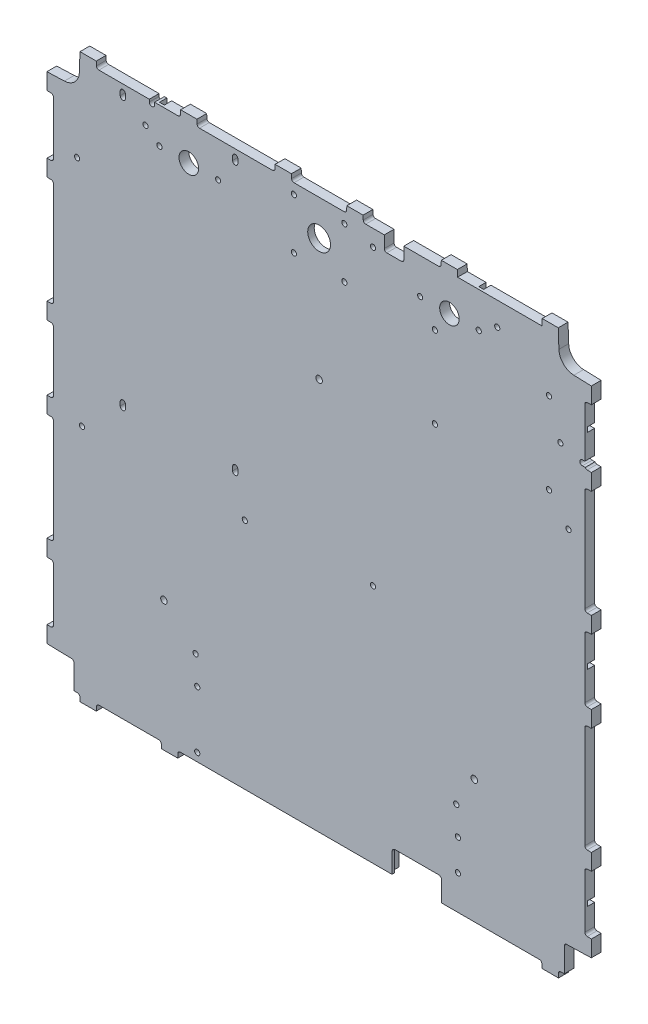
from build123d import *

# Parameters (mm, degrees)
SALIENTE_EXTRUIR1_DEPTH                              = 6
CROQUIS2_W                                           = 301
CROQUIS2_H                                           = 6
SALIENTE_EXTRUIR2_DEPTH                              = 20.342813889
CROQUIS3_W                                           = 39.720633844
CROQUIS3_H                                           = 4
CORTAR_EXTRUIR1_DEPTH                                = 241.454257604
CROQUIS4_W                                           = 4
CROQUIS4_H                                           = 35.720633844
CORTAR_EXTRUIR2_DEPTH                                = 241.454257604
CROQUIS5_W                                           = 4
CROQUIS5_H                                           = 39.720633844
CORTAR_EXTRUIR3_DEPTH                                = 241.454257604
CROQUIS6_W                                           = 4
CROQUIS6_H                                           = 35.720633844
CORTAR_EXTRUIR4_DEPTH                                = 241.454257604
CROQUIS7_W                                           = 51.8
CROQUIS7_H                                           = 4
CORTAR_EXTRUIR5_DEPTH                                = 241.454257604
CORTAR_EXTRUIR6_DEPTH                                = 4.5
CORTAR_EXTRUIR7_DEPTH                                = 4.5
CORTAR_EXTRUIR8_DEPTH                                = 4.5
CORTAR_EXTRUIR9_DEPTH                                = 4.5
CORTAR_EXTRUIR10_DEPTH                               = 4.5
CORTAR_EXTRUIR11_DEPTH                               = 4.5
CORTAR_EXTRUIR12_DEPTH                               = 4.5
CORTAR_EXTRUIR13_DEPTH                               = 241.454257604
CROQUIS16_W                                          = 1.75
CROQUIS16_H                                          = 4.5
CORTAR_EXTRUIR14_DEPTH                               = 14.1
CROQUIS17_W                                          = 131.410316922
CROQUIS17_H                                          = 4
CORTAR_EXTRUIR15_DEPTH                               = 241.454257604
CROQUIS18_W                                          = 1.75
CROQUIS18_H                                          = 4.5
CORTAR_EXTRUIR16_DEPTH                               = 14.1
CORTAR_EXTRUIR17_DEPTH                               = 4.5
CORTAR_EXTRUIR18_DEPTH                               = 4.5
CORTAR_EXTRUIR19_DEPTH                               = 4.5
CORTAR_EXTRUIR20_DEPTH                               = 4.5
CORTAR_EXTRUIR21_DEPTH                               = 4.5
CROQUIS24_W                                          = 48
CROQUIS24_H                                          = 4
CORTAR_EXTRUIR22_DEPTH                               = 241.454257604
CROQUIS25_W                                          = 34
CROQUIS25_H                                          = 4
CORTAR_EXTRUIR23_DEPTH                               = 241.454257604
CORTAR_EXTRUIR24_DEPTH                               = 241.454257604
CORTAR_EXTRUIR25_DEPTH                               = 241.454257604
CORTAR_EXTRUIR26_DEPTH                               = 241.454257604
CORTAR_EXTRUIR27_DEPTH                               = 241.454257604
CROQUIS30_W                                          = 3.560316922
CROQUIS30_H                                          = 4
CORTAR_EXTRUIR28_DEPTH                               = 241.454257604
CROQUIS31_W                                          = 4
CROQUIS31_H                                          = 65.720633844
CORTAR_EXTRUIR29_DEPTH                               = 241.454257604
CROQUIS32_W                                          = 4
CROQUIS32_H                                          = 65.720633844
CORTAR_EXTRUIR30_DEPTH                               = 241.454257604
CORTAR_EXTRUIR31_DEPTH                               = 241.454257604
CORTAR_EXTRUIR32_DEPTH                               = 241.454257604
CORTAR_EXTRUIR33_DEPTH                               = 241.454257604
CORTAR_EXTRUIR34_DEPTH                               = 241.454257604
CORTAR_EXTRUIR35_DEPTH                               = 241.454257604
CORTAR_EXTRUIR36_DEPTH                               = 241.454257604
CORTAR_EXTRUIR37_DEPTH                               = 4.5
CORTAR_EXTRUIR38_DEPTH                               = 4.5
CROQUIS42_W                                          = 20
CROQUIS42_H                                          = 4.5
CORTAR_EXTRUIR39_DEPTH                               = 15
CORTAR_EXTRUIR40_DEPTH                               = 4.5
NGULO_DE_SALIDA1_ANGLE                               = 1.443471022
NGULO_DE_SALIDA2_ANGLE                               = 2
NGULO_DE_SALIDA3_ANGLE                               = 2
NGULO_DE_SALIDA4_ANGLE                               = 1.443471022
NGULO_DE_SALIDA5_ANGLE                               = 2
NGULO_DE_SALIDA6_ANGLE                               = 2
NGULO_DE_SALIDA7_ANGLE                               = 2
NGULO_DE_SALIDA8_ANGLE                               = 2
NGULO_DE_SALIDA9_ANGLE                               = 2
NGULO_DE_SALIDA10_ANGLE                              = 2
NGULO_DE_SALIDA11_ANGLE                              = 2
NGULO_DE_SALIDA12_ANGLE                              = 2
NGULO_DE_SALIDA13_ANGLE                              = 2
NGULO_DE_SALIDA14_ANGLE                              = 2
NGULO_DE_SALIDA15_ANGLE                              = 2
NGULO_DE_SALIDA16_ANGLE                              = 2
NGULO_DE_SALIDA17_ANGLE                              = 2
NGULO_DE_SALIDA18_ANGLE                              = 2
NGULO_DE_SALIDA19_ANGLE                              = 2
NGULO_DE_SALIDA20_ANGLE                              = 2
NGULO_DE_SALIDA21_ANGLE                              = 2
NGULO_DE_SALIDA22_ANGLE                              = 2
DI_METRO_DE_TALADRO_12_0_12_1_D                      = 12
DI_METRO_DE_TALADRO_4_0_4_1_D                        = 4
DI_METRO_DE_TALADRO_3_2_3_2_1_D                      = 3.2
DI_METRO_DE_TALADRO_3_2_3_2_2_D                      = 3.2
REFRENTADO_PARA_PERNO_CON_CABEZA_HEXAGON_D           = 14
REFRENTADO_PARA_PERNO_CON_CABEZA_HEXAGON_CBORE_D     = 22.2
REFRENTADO_PARA_PERNO_CON_CABEZA_HEXAGON_CBORE_DEPTH = 2
REFRENTADO_PARA_TORNILLO_CON_CABEZA_HEXA_D           = 3.2
REFRENTADO_PARA_TORNILLO_CON_CABEZA_HEXA_CBORE_D     = 10
REFRENTADO_PARA_TORNILLO_CON_CABEZA_HEXA_CBORE_DEPTH = 2
REFRENTADO_PARA_TORNILLO_CON_CABEZA_2_D              = 3.1
REFRENTADO_PARA_TORNILLO_CON_CABEZA_2_CBORE_D        = 10
REFRENTADO_PARA_TORNILLO_CON_CABEZA_2_CBORE_DEPTH    = 2
REDONDEO1_R                                          = 1.5
REDONDEO2_R                                          = 2
REDONDEO3_R                                          = 9.5


with BuildPart() as part:
    # Croquis1 → Saliente-Extruir1 (new body)
    with BuildSketch(Plane(origin=(0, 0, -3), x_dir=(-1, 0, 0), z_dir=(0, 0, -1))):
        Polygon((-167.1, -152), (-154.007902719, -152.457186111), (154.007902719, -152.457186111), (167.1, -152), (167.1, 172.8), (-167.1, 172.8), align=None)
    extrude(amount=-SALIENTE_EXTRUIR1_DEPTH)

    # Croquis2 → Saliente-Extruir2 (add)
    with BuildSketch(Plane.XZ.offset(152.457186111)):
        Rectangle(CROQUIS2_W, CROQUIS2_H)
    extrude(amount=SALIENTE_EXTRUIR2_DEPTH)

    # Croquis3 → Cortar-Extruir1 (cut, through all)
    with BuildSketch(Plane.XY.offset(3)):
        with Locations((-116.8, -170.8)):
            Rectangle(CROQUIS3_W, CROQUIS3_H)
    extrude(amount=-CORTAR_EXTRUIR1_DEPTH, mode=Mode.SUBTRACT)

    # Croquis4 → Cortar-Extruir2 (cut, through all)
    with BuildSketch(Plane.XY.offset(3)):
        with Locations((-165.1, -124)):
            Rectangle(CROQUIS4_W, CROQUIS4_H)
    cortar_extruir2 = extrude(amount=-CORTAR_EXTRUIR2_DEPTH, mode=Mode.SUBTRACT)

    # Croquis5 → Cortar-Extruir3 (cut, through all)
    with BuildSketch(Plane.XY.offset(3)):
        with Locations((-165.1, 0)):
            Rectangle(CROQUIS5_W, CROQUIS5_H)
    cortar_extruir3 = extrude(amount=-CORTAR_EXTRUIR3_DEPTH, mode=Mode.SUBTRACT)

    # Croquis6 → Cortar-Extruir4 (cut, through all)
    with BuildSketch(Plane.XY.offset(3)):
        with Locations((-165.1, 124)):
            Rectangle(CROQUIS6_W, CROQUIS6_H)
    extrude(amount=-CORTAR_EXTRUIR4_DEPTH, mode=Mode.SUBTRACT)

    # Croquis7 → Cortar-Extruir5 (cut, through all)
    with BuildSketch(Plane.XY.offset(3)):
        with Locations((-110.9, 170.8)):
            Rectangle(CROQUIS7_W, CROQUIS7_H)
    cortar_extruir5 = extrude(amount=-CORTAR_EXTRUIR5_DEPTH, mode=Mode.SUBTRACT)

    # Croquis8 → Cortar-Extruir6 (cut)
    with BuildSketch(Plane(origin=(0, 0, -3), x_dir=(-1, 0, 0), z_dir=(0, 0, -1))):
        with BuildLine():
            Line((-167.1, 124.5), (-156.779019946, 124.5))
            ThreePointArc((-156.779019946, 124.5), (-156.268245837, 123.604356076), (-155.3, 123.25))
            Line((-155.3, 123.25), (-153.9, 123.25))
            ThreePointArc((-153.9, 123.25), (-152.931754163, 123.604356076), (-152.420980054, 124.5))
            Line((-152.420980054, 124.5), (-152.420980054, 127.5))
            ThreePointArc((-152.420980054, 127.5), (-152.931754163, 128.395643924), (-153.9, 128.75))
            Line((-153.9, 128.75), (-155.3, 128.75))
            ThreePointArc((-155.3, 128.75), (-156.268245837, 128.395643924), (-156.779019946, 127.5))
            Line((-156.779019946, 127.5), (-167.1, 127.5))
            Line((-167.1, 127.5), (-167.1, 124.5))
        make_face()
    extrude(amount=-CORTAR_EXTRUIR6_DEPTH, mode=Mode.SUBTRACT)

    # Croquis9 → Cortar-Extruir7 (cut)
    with BuildSketch(Plane(origin=(0, 0, -3), x_dir=(-1, 0, 0), z_dir=(0, 0, -1))):
        with BuildLine():
            Line((-115.3, -172.8), (-115.3, -162.479019946))
            ThreePointArc((-115.3, -162.479019946), (-114.404356076, -161.968245837), (-114.05, -161))
            Line((-114.05, -161), (-114.05, -159.6))
            ThreePointArc((-114.05, -159.6), (-114.404356076, -158.631754163), (-115.3, -158.120980054))
            Line((-115.3, -158.120980054), (-118.3, -158.120980054))
            ThreePointArc((-118.3, -158.120980054), (-119.195643924, -158.631754163), (-119.55, -159.6))
            Line((-119.55, -159.6), (-119.55, -161))
            ThreePointArc((-119.55, -161), (-119.195643924, -161.968245837), (-118.3, -162.479019946))
            Line((-118.3, -162.479019946), (-118.3, -172.8))
            Line((-118.3, -172.8), (-115.3, -172.8))
        make_face()
    extrude(amount=-CORTAR_EXTRUIR7_DEPTH, mode=Mode.SUBTRACT)

    # Croquis10 → Cortar-Extruir8 (cut)
    with BuildSketch(Plane(origin=(0, 0, -3), x_dir=(-1, 0, 0), z_dir=(0, 0, -1))):
        with BuildLine():
            Line((118.3, -168.8), (118.3, -162.479019946))
            ThreePointArc((118.3, -162.479019946), (119.195643924, -161.968245837), (119.55, -161))
            Line((119.55, -161), (119.55, -159.6))
            ThreePointArc((119.55, -159.6), (119.195643924, -158.631754163), (118.3, -158.120980054))
            Line((118.3, -158.120980054), (115.3, -158.120980054))
            ThreePointArc((115.3, -158.120980054), (114.404356076, -158.631754163), (114.05, -159.6))
            Line((114.05, -159.6), (114.05, -161))
            ThreePointArc((114.05, -161), (114.404356076, -161.968245837), (115.3, -162.479019946))
            Line((115.3, -162.479019946), (115.3, -168.8))
            Line((115.3, -168.8), (118.3, -168.8))
        make_face()
    extrude(amount=-CORTAR_EXTRUIR8_DEPTH, mode=Mode.SUBTRACT)

    # Croquis11 → Cortar-Extruir9 (cut)
    with BuildSketch(Plane(origin=(0, 0, -3), x_dir=(-1, 0, 0), z_dir=(0, 0, -1))):
        with BuildLine():
            Line((163.1, -124.5), (156.779019946, -124.5))
            ThreePointArc((156.779019946, -124.5), (156.268245837, -123.604356076), (155.3, -123.25))
            Line((155.3, -123.25), (153.9, -123.25))
            ThreePointArc((153.9, -123.25), (152.931754163, -123.604356076), (152.420980054, -124.5))
            Line((152.420980054, -124.5), (152.420980054, -127.5))
            ThreePointArc((152.420980054, -127.5), (152.931754163, -128.395643924), (153.9, -128.75))
            Line((153.9, -128.75), (155.3, -128.75))
            ThreePointArc((155.3, -128.75), (156.268245837, -128.395643924), (156.779019946, -127.5))
            Line((156.779019946, -127.5), (163.1, -127.5))
            Line((163.1, -127.5), (163.1, -124.5))
        make_face()
    cortar_extruir9 = extrude(amount=-CORTAR_EXTRUIR9_DEPTH, mode=Mode.SUBTRACT)

    # Croquis12 → Cortar-Extruir10 (cut)
    with BuildSketch(Plane(origin=(0, 0, -3), x_dir=(-1, 0, 0), z_dir=(0, 0, -1))):
        with BuildLine():
            Line((163.1, 1.5), (156.779019946, 1.5))
            ThreePointArc((156.779019946, 1.5), (156.268245837, 2.395643924), (155.3, 2.75))
            Line((155.3, 2.75), (153.9, 2.75))
            ThreePointArc((153.9, 2.75), (152.931754163, 2.395643924), (152.420980054, 1.5))
            Line((152.420980054, 1.5), (152.420980054, -1.5))
            ThreePointArc((152.420980054, -1.5), (152.931754163, -2.395643924), (153.9, -2.75))
            Line((153.9, -2.75), (155.3, -2.75))
            ThreePointArc((155.3, -2.75), (156.268245837, -2.395643924), (156.779019946, -1.5))
            Line((156.779019946, -1.5), (163.1, -1.5))
            Line((163.1, -1.5), (163.1, 1.5))
        make_face()
    cortar_extruir10 = extrude(amount=-CORTAR_EXTRUIR10_DEPTH, mode=Mode.SUBTRACT)

    # Croquis13 → Cortar-Extruir11 (cut)
    with BuildSketch(Plane(origin=(0, 0, -3), x_dir=(-1, 0, 0), z_dir=(0, 0, -1))):
        with BuildLine():
            Line((163.1, 127.5), (156.779019946, 127.5))
            ThreePointArc((156.779019946, 127.5), (156.268245837, 128.395643924), (155.3, 128.75))
            Line((155.3, 128.75), (153.9, 128.75))
            ThreePointArc((153.9, 128.75), (152.931754163, 128.395643924), (152.420980054, 127.5))
            Line((152.420980054, 127.5), (152.420980054, 124.5))
            ThreePointArc((152.420980054, 124.5), (152.931754163, 123.604356076), (153.9, 123.25))
            Line((153.9, 123.25), (155.3, 123.25))
            ThreePointArc((155.3, 123.25), (156.268245837, 123.604356076), (156.779019946, 124.5))
            Line((156.779019946, 124.5), (163.1, 124.5))
            Line((163.1, 124.5), (163.1, 127.5))
        make_face()
    extrude(amount=-CORTAR_EXTRUIR11_DEPTH, mode=Mode.SUBTRACT)

    # Croquis14 → Cortar-Extruir12 (cut)
    with BuildSketch(Plane(origin=(0, 0, -3), x_dir=(-1, 0, 0), z_dir=(0, 0, -1))):
        with BuildLine():
            Line((96.5, 168.8), (96.5, 162.479019946))
            ThreePointArc((96.5, 162.479019946), (95.604356076, 161.968245837), (95.25, 161))
            Line((95.25, 161), (95.25, 159.6))
            ThreePointArc((95.25, 159.6), (95.604356076, 158.631754163), (96.5, 158.120980054))
            Line((96.5, 158.120980054), (99.5, 158.120980054))
            ThreePointArc((99.5, 158.120980054), (100.395643924, 158.631754163), (100.75, 159.6))
            Line((100.75, 159.6), (100.75, 161))
            ThreePointArc((100.75, 161), (100.395643924, 161.968245837), (99.5, 162.479019946))
            Line((99.5, 162.479019946), (99.5, 168.8))
            Line((99.5, 168.8), (96.5, 168.8))
        make_face()
    cortar_extruir12 = extrude(amount=-CORTAR_EXTRUIR12_DEPTH, mode=Mode.SUBTRACT)

    # Croquis15 → Cortar-Extruir13 (cut, through all)
    with BuildSketch(Plane.XY.offset(3)):
        Polygon((44.75, -172.8), (136.8, -172.8), (136.8, -168.8), (75.25, -168.8), (75.25, -154.7), (44.75, -154.7), align=None)
    extrude(amount=-CORTAR_EXTRUIR13_DEPTH, mode=Mode.SUBTRACT)

    # Croquis16 → Cortar-Extruir14 (cut)
    with BuildSketch(Plane.XZ.offset(168.8)):
        with Locations((76.125, -0.75)):
            Rectangle(CROQUIS16_W, CROQUIS16_H)
    extrude(amount=-CORTAR_EXTRUIR14_DEPTH, mode=Mode.SUBTRACT)

    # Croquis17 → Cortar-Extruir15 (cut, through all)
    with BuildSketch(Plane(origin=(0, 0, -3), x_dir=(-1, 0, 0), z_dir=(0, 0, -1))):
        with Locations((20.955158461, -170.8)):
            Rectangle(CROQUIS17_W, CROQUIS17_H)
    extrude(amount=-CORTAR_EXTRUIR15_DEPTH, mode=Mode.SUBTRACT)

    # Croquis18 → Cortar-Extruir16 (cut)
    with BuildSketch(Plane.XZ.offset(168.8)):
        with Locations((43.875, -0.75)):
            Rectangle(CROQUIS18_W, CROQUIS18_H)
    extrude(amount=-CORTAR_EXTRUIR16_DEPTH, mode=Mode.SUBTRACT)

    # Croquis19 → Cortar-Extruir17 (cut)
    with BuildSketch(Plane(origin=(0, 0, -3), x_dir=(-1, 0, 0), z_dir=(0, 0, -1))):
        with BuildLine():
            Line((99.337509594, 158.120980054), (96.662490406, 158.120980054))
            ThreePointArc((96.662490406, 158.120980054), (98, 157.3), (99.337509594, 158.120980054))
        make_face()
    cortar_extruir17 = extrude(amount=-CORTAR_EXTRUIR17_DEPTH, mode=Mode.SUBTRACT)

    # Croquis20 → Cortar-Extruir18 (cut)
    with BuildSketch(Plane(origin=(0, 0, -3), x_dir=(-1, 0, 0), z_dir=(0, 0, -1))):
        with BuildLine():
            Line((152.420980054, 124.662490406), (152.420980054, 127.337509594))
            ThreePointArc((152.420980054, 127.337509594), (151.6, 126), (152.420980054, 124.662490406))
        make_face()
    cortar_extruir18 = extrude(amount=-CORTAR_EXTRUIR18_DEPTH, mode=Mode.SUBTRACT)

    # Croquis21 → Cortar-Extruir19 (cut)
    with BuildSketch(Plane(origin=(0, 0, -3), x_dir=(-1, 0, 0), z_dir=(0, 0, -1))):
        with BuildLine():
            Line((152.420980054, -1.337509594), (152.420980054, 1.337509594))
            ThreePointArc((152.420980054, 1.337509594), (151.6, 0), (152.420980054, -1.337509594))
        make_face()
    cortar_extruir19 = extrude(amount=-CORTAR_EXTRUIR19_DEPTH, mode=Mode.SUBTRACT)

    # Croquis22 → Cortar-Extruir20 (cut)
    with BuildSketch(Plane(origin=(0, 0, -3), x_dir=(-1, 0, 0), z_dir=(0, 0, -1))):
        with BuildLine():
            Line((152.420980054, -127.337509594), (152.420980054, -124.662490406))
            ThreePointArc((152.420980054, -124.662490406), (151.6, -126), (152.420980054, -127.337509594))
        make_face()
    cortar_extruir20 = extrude(amount=-CORTAR_EXTRUIR20_DEPTH, mode=Mode.SUBTRACT)

    # Croquis23 → Cortar-Extruir21 (cut)
    with BuildSketch(Plane(origin=(0, 0, -3), x_dir=(-1, 0, 0), z_dir=(0, 0, -1))):
        with BuildLine():
            Line((115.462490406, -158.120980054), (118.137509594, -158.120980054))
            ThreePointArc((118.137509594, -158.120980054), (116.8, -157.3), (115.462490406, -158.120980054))
        make_face()
    cortar_extruir21 = extrude(amount=-CORTAR_EXTRUIR21_DEPTH, mode=Mode.SUBTRACT)

    # Croquis24 → Cortar-Extruir22 (cut, through all)
    with BuildSketch(Plane.XY.offset(3)):
        with Locations((-51, 170.8)):
            Rectangle(CROQUIS24_W, CROQUIS24_H)
    extrude(amount=-CORTAR_EXTRUIR22_DEPTH, mode=Mode.SUBTRACT)

    # Croquis25 → Cortar-Extruir23 (cut, through all)
    with BuildSketch(Plane.XY.offset(3)):
        with Locations((0, 170.8)):
            Rectangle(CROQUIS25_W, CROQUIS25_H)
    extrude(amount=-CORTAR_EXTRUIR23_DEPTH, mode=Mode.SUBTRACT)

    # Croquis26 → Cortar-Extruir24 (cut, through all)
    with BuildSketch(Plane.XY.offset(3)):
        Polygon((27, 172.8), (27, 168.8), (40, 168.8), (40, 160), (52, 160), (52, 168.8), (74.860316922, 168.8), (74.860316922, 172.8), align=None)
    extrude(amount=-CORTAR_EXTRUIR24_DEPTH, mode=Mode.SUBTRACT)

    # Croquis27 → Cortar-Extruir25 (cut, through all)
    with BuildSketch(Plane.XY.offset(3)):
        Polygon((167.1, 172.8), (146.8, 172.8), (147.526352005, 152), (167.1, 152), align=None)
    extrude(amount=-CORTAR_EXTRUIR25_DEPTH, mode=Mode.SUBTRACT)

    # Croquis28 → Cortar-Extruir26 (cut, through all)
    with BuildSketch(Plane.XY.offset(3)):
        with BuildLine():
            Line((167.1, 106.82), (167.1, 142))
            Line((167.1, 142), (163.1, 142))
            Line((163.1, 142), (163.1, 110.02))
            Line((163.1, 110.02), (161.6, 110.02))
            ThreePointArc((161.6, 110.02), (160, 108.42), (161.6, 106.82))
            Line((161.6, 106.82), (167.1, 106.82))
        make_face()
    extrude(amount=-CORTAR_EXTRUIR26_DEPTH, mode=Mode.SUBTRACT)

    # Croquis29 → Cortar-Extruir27 (cut, through all)
    with BuildSketch(Plane.XY.offset(3)):
        with BuildLine():
            Line((164.547650755, 106.08913), (167.1, 106))
            Line((167.1, 106), (167.1, 106.82))
            Line((167.1, 106.82), (163.311650743, 106.82))
            ThreePointArc((163.311650743, 106.82), (163.836514009, 106.297058178), (164.547650755, 106.08913))
        make_face()
    extrude(amount=-CORTAR_EXTRUIR27_DEPTH, mode=Mode.SUBTRACT)

    # Croquis30 → Cortar-Extruir28 (cut, through all)
    with BuildSketch(Plane.XY.offset(3)):
        with Locations((-148.719841539, -170.8)):
            Rectangle(CROQUIS30_W, CROQUIS30_H)
    cortar_extruir28 = extrude(amount=-CORTAR_EXTRUIR28_DEPTH, mode=Mode.SUBTRACT)

    # Croquis31 → Cortar-Extruir29 (cut, through all)
    with BuildSketch(Plane.XY.offset(3)):
        with Locations((-165.1, -63)):
            Rectangle(CROQUIS31_W, CROQUIS31_H)
    cortar_extruir29 = extrude(amount=-CORTAR_EXTRUIR29_DEPTH, mode=Mode.SUBTRACT)

    # Croquis32 → Cortar-Extruir30 (cut, through all)
    with BuildSketch(Plane.XY.offset(3)):
        with Locations((-165.1, 63)):
            Rectangle(CROQUIS32_W, CROQUIS32_H)
    cortar_extruir30 = extrude(amount=-CORTAR_EXTRUIR30_DEPTH, mode=Mode.SUBTRACT)

    # Simetría1: Cortar-Extruir2, Cortar-Extruir3, Cortar-Extruir5, Cortar-Extruir9, Cortar-Extruir10, Cortar-Extruir12, Cortar-Extruir17, Cortar-Extruir18, Cortar-Extruir19, Cortar-Extruir20, Cortar-Extruir21, Cortar-Extruir28, Cortar-Extruir29, Cortar-Extruir30 across plane
    add(cortar_extruir2.mirror(Plane(origin=(0, 0, 0), x_dir=(0, 0, 1), z_dir=(1, 0, 0))), mode=Mode.SUBTRACT)
    add(cortar_extruir3.mirror(Plane(origin=(0, 0, 0), x_dir=(0, 0, 1), z_dir=(1, 0, 0))), mode=Mode.SUBTRACT)
    add(cortar_extruir5.mirror(Plane(origin=(0, 0, 0), x_dir=(0, 0, 1), z_dir=(1, 0, 0))), mode=Mode.SUBTRACT)
    add(cortar_extruir9.mirror(Plane(origin=(0, 0, 0), x_dir=(0, 0, 1), z_dir=(1, 0, 0))), mode=Mode.SUBTRACT)
    add(cortar_extruir10.mirror(Plane(origin=(0, 0, 0), x_dir=(0, 0, 1), z_dir=(1, 0, 0))), mode=Mode.SUBTRACT)
    add(cortar_extruir12.mirror(Plane(origin=(0, 0, 0), x_dir=(0, 0, 1), z_dir=(1, 0, 0))), mode=Mode.SUBTRACT)
    add(cortar_extruir17.mirror(Plane(origin=(0, 0, 0), x_dir=(0, 0, 1), z_dir=(1, 0, 0))), mode=Mode.SUBTRACT)
    add(cortar_extruir18.mirror(Plane(origin=(0, 0, 0), x_dir=(0, 0, 1), z_dir=(1, 0, 0))), mode=Mode.SUBTRACT)
    add(cortar_extruir19.mirror(Plane(origin=(0, 0, 0), x_dir=(0, 0, 1), z_dir=(1, 0, 0))), mode=Mode.SUBTRACT)
    add(cortar_extruir20.mirror(Plane(origin=(0, 0, 0), x_dir=(0, 0, 1), z_dir=(1, 0, 0))), mode=Mode.SUBTRACT)
    add(cortar_extruir21.mirror(Plane(origin=(0, 0, 0), x_dir=(0, 0, 1), z_dir=(1, 0, 0))), mode=Mode.SUBTRACT)
    add(cortar_extruir28.mirror(Plane(origin=(0, 0, 0), x_dir=(0, 0, 1), z_dir=(1, 0, 0))), mode=Mode.SUBTRACT)
    add(cortar_extruir29.mirror(Plane(origin=(0, 0, 0), x_dir=(0, 0, 1), z_dir=(1, 0, 0))), mode=Mode.SUBTRACT)
    add(cortar_extruir30.mirror(Plane(origin=(0, 0, 0), x_dir=(0, 0, 1), z_dir=(1, 0, 0))), mode=Mode.SUBTRACT)

    # Croquis34 → Cortar-Extruir31 (cut, through all)
    with BuildSketch(Plane.XY.offset(3)):
        Polygon((-167.1, 172.8), (-167.1, 152), (-146.8, 152.708891621), (-146.8, 172.8), align=None)
    extrude(amount=-CORTAR_EXTRUIR31_DEPTH, mode=Mode.SUBTRACT)

    # Croquis35 → Cortar-Extruir32 (cut, through all)
    with BuildSketch(Plane.XY.offset(3)):
        with BuildLine():
            Line((-101.02, 168.8), (-104.22, 168.8))
            Line((-104.22, 168.8), (-104.22, 167.3))
            ThreePointArc((-104.22, 167.3), (-102.62, 165.7), (-101.02, 167.3))
            Line((-101.02, 167.3), (-101.02, 168.8))
        make_face()
    extrude(amount=-CORTAR_EXTRUIR32_DEPTH, mode=Mode.SUBTRACT)

    # Croquis36 → Cortar-Extruir33 (cut, through all)
    with BuildSketch(Plane(origin=(0, 0, -3), x_dir=(-1, 0, 0), z_dir=(0, 0, -1))):
        with BuildLine():
            Line((49.9, -0.75), (49.9, -3.25))
            ThreePointArc((49.9, -3.25), (51.5, -4.85), (53.1, -3.25))
            Line((53.1, -3.25), (53.1, -0.75))
            ThreePointArc((53.1, -0.75), (51.5, 0.85), (49.9, -0.75))
        make_face()
    extrude(amount=-CORTAR_EXTRUIR33_DEPTH, mode=Mode.SUBTRACT)

    # Croquis37 → Cortar-Extruir34 (cut, through all)
    with BuildSketch(Plane(origin=(0, 0, -3), x_dir=(-1, 0, 0), z_dir=(0, 0, -1))):
        with BuildLine():
            Line((118.9, -0.75), (118.9, -3.25))
            ThreePointArc((118.9, -3.25), (120.5, -4.85), (122.1, -3.25))
            Line((122.1, -3.25), (122.1, -0.75))
            ThreePointArc((122.1, -0.75), (120.5, 0.85), (118.9, -0.75))
        make_face()
    extrude(amount=-CORTAR_EXTRUIR34_DEPTH, mode=Mode.SUBTRACT)

    # Croquis38 → Cortar-Extruir35 (cut, through all)
    with BuildSketch(Plane(origin=(0, 0, -3), x_dir=(-1, 0, 0), z_dir=(0, 0, -1))):
        with BuildLine():
            Line((122.1, 161.75), (122.1, 164.25))
            ThreePointArc((122.1, 164.25), (120.5, 165.85), (118.9, 164.25))
            Line((118.9, 164.25), (118.9, 161.75))
            ThreePointArc((118.9, 161.75), (120.5, 160.15), (122.1, 161.75))
        make_face()
    extrude(amount=-CORTAR_EXTRUIR35_DEPTH, mode=Mode.SUBTRACT)

    # Croquis39 → Cortar-Extruir36 (cut, through all)
    with BuildSketch(Plane.XY.offset(3)):
        with BuildLine():
            Line((-53.1, 164.25), (-53.1, 161.75))
            ThreePointArc((-53.1, 161.75), (-51.5, 160.15), (-49.9, 161.75))
            Line((-49.9, 161.75), (-49.9, 164.25))
            ThreePointArc((-49.9, 164.25), (-51.5, 165.85), (-53.1, 164.25))
        make_face()
    extrude(amount=-CORTAR_EXTRUIR36_DEPTH, mode=Mode.SUBTRACT)

    # Croquis40 → Cortar-Extruir37 (cut)
    with BuildSketch(Plane(origin=(0, 0, -3), x_dir=(-1, 0, 0), z_dir=(0, 0, -1))):
        with BuildLine():
            Line((86.9, -127.8), (86.9, -125.8))
            ThreePointArc((86.9, -125.8), (85.3, -124.2), (83.7, -125.8))
            Line((83.7, -125.8), (83.7, -127.8))
            ThreePointArc((83.7, -127.8), (85.3, -129.4), (86.9, -127.8))
        make_face()
    extrude(amount=-CORTAR_EXTRUIR37_DEPTH, mode=Mode.SUBTRACT)

    # Croquis41 → Cortar-Extruir38 (cut)
    with BuildSketch(Plane(origin=(0, 0, -3), x_dir=(-1, 0, 0), z_dir=(0, 0, -1))):
        with BuildLine():
            Line((-92.1, -127.8), (-92.1, -125.8))
            ThreePointArc((-92.1, -125.8), (-93.7, -124.2), (-95.3, -125.8))
            Line((-95.3, -125.8), (-95.3, -127.8))
            ThreePointArc((-95.3, -127.8), (-93.7, -129.4), (-92.1, -127.8))
        make_face()
    extrude(amount=-CORTAR_EXTRUIR38_DEPTH, mode=Mode.SUBTRACT)

    # Croquis42 → Cortar-Extruir39 (cut)
    with BuildSketch(Plane.XZ.offset(154.7)):
        with Locations((60, -0.75)):
            Rectangle(CROQUIS42_W, CROQUIS42_H)
    extrude(amount=-CORTAR_EXTRUIR39_DEPTH, mode=Mode.SUBTRACT)

    # Croquis43 → Cortar-Extruir40 (cut)
    with BuildSketch(Plane(origin=(0, 0, -3), x_dir=(-1, 0, 0), z_dir=(0, 0, -1))):
        with BuildLine():
            Line((27.1, 19.8), (27.1, 17.8))
            ThreePointArc((27.1, 17.8), (29.1, 15.8), (31.1, 17.8))
            Line((31.1, 17.8), (31.1, 19.8))
            ThreePointArc((31.1, 19.8), (29.1, 21.8), (27.1, 19.8))
        make_face()
    extrude(amount=-CORTAR_EXTRUIR40_DEPTH, mode=Mode.SUBTRACT)

    # Ángulo de salida1
    ngulo_de_salida1_faces = [part.faces().sort_by_distance(p)[0] for p in [
        (-152.25395136, -152.457186111, 0),
    ]]
    draft(ngulo_de_salida1_faces, Plane(origin=(-150.5, -172.8, -3), x_dir=(0, 0, -1), z_dir=(-1, 0, 0)), NGULO_DE_SALIDA1_ANGLE)

    # Ángulo de salida2
    ngulo_de_salida2_faces = [part.faces().sort_by_distance(p)[0] for p in [
        (-146.939683078, -170.8, 0),
    ]]
    draft(ngulo_de_salida2_faces, Plane(origin=(-146.939683078, -168.8, -3.00005), x_dir=(-1, 0, 0), z_dir=(0, -1, 0)), NGULO_DE_SALIDA2_ANGLE)

    # Ángulo de salida3
    ngulo_de_salida3_faces = [part.faces().sort_by_distance(p)[0] for p in [
        (-86.660316922, -170.8, 0),
    ]]
    draft(ngulo_de_salida3_faces, Plane(origin=(-86.660316922, -168.8, 3.00005), x_dir=(-1, 0, 0), z_dir=(0, -1, 0)), NGULO_DE_SALIDA3_ANGLE)

    # Ángulo de salida4
    ngulo_de_salida4_faces = [part.faces().sort_by_distance(p)[0] for p in [
        (152.25395136, -152.457186111, 0),
    ]]
    draft(ngulo_de_salida4_faces, Plane(origin=(150.5, -172.8, 3), x_dir=(0, 0, 1), z_dir=(1, 0, 0)), NGULO_DE_SALIDA4_ANGLE)

    # Ángulo de salida5
    ngulo_de_salida5_faces = [part.faces().sort_by_distance(p)[0] for p in [
        (74.860316922, 170.8, 0),
    ]]
    draft(ngulo_de_salida5_faces, Plane(origin=(52, 168.8, -3.00005), x_dir=(0, 0, 1), z_dir=(0, 1, 0)), NGULO_DE_SALIDA5_ANGLE)

    # Ángulo de salida6
    ngulo_de_salida6_faces = [part.faces().sort_by_distance(p)[0] for p in [
        (-146.8, 162.75444581, 0),
        (-136.8, 170.8, 0),
    ]]
    draft(ngulo_de_salida6_faces, Plane(origin=(-167.1, 172.8, 3), x_dir=(0, 0, 1), z_dir=(0, 1, 0)), NGULO_DE_SALIDA6_ANGLE)

    # Ángulo de salida7
    ngulo_de_salida7_faces = [part.faces().sort_by_distance(p)[0] for p in [
        (-165.1, 95.860316922, 0),
        (-165.1, 30.139683078, 0),
    ]]
    draft(ngulo_de_salida7_faces, Plane(origin=(-163.1, 30.139683078, -3.00005), x_dir=(0, 0, -1), z_dir=(-1, 0, 0)), NGULO_DE_SALIDA7_ANGLE)

    # Ángulo de salida8
    ngulo_de_salida8_faces = [part.faces().sort_by_distance(p)[0] for p in [
        (-165.1, -30.139683078, 0),
        (-165.1, -95.860316922, 0),
    ]]
    draft(ngulo_de_salida8_faces, Plane(origin=(-163.1, -95.860316922, -3.00005), x_dir=(0, -1, 0), z_dir=(-1, 0, 0)), NGULO_DE_SALIDA8_ANGLE)

    # Ángulo de salida9
    ngulo_de_salida9_faces = [part.faces().sort_by_distance(p)[0] for p in [
        (165.1, -95.860316922, 0),
        (165.1, -30.139683078, 0),
    ]]
    draft(ngulo_de_salida9_faces, Plane(origin=(163.1, -95.860316922, -3.00005), x_dir=(0, 1, 0), z_dir=(1, 0, 0)), NGULO_DE_SALIDA9_ANGLE)

    # Ángulo de salida10
    ngulo_de_salida10_faces = [part.faces().sort_by_distance(p)[0] for p in [
        (165.1, 30.139683078, 0),
        (165.1, 95.860316922, 0),
    ]]
    draft(ngulo_de_salida10_faces, Plane(origin=(163.1, 30.139683078, -3.00005), x_dir=(0, 0, 1), z_dir=(1, 0, 0)), NGULO_DE_SALIDA10_ANGLE)

    # Ángulo de salida11
    ngulo_de_salida11_faces = [part.faces().sort_by_distance(p)[0] for p in [
        (165.1, 142, 0),
        (157.313176003, 152, 0),
    ]]
    draft(ngulo_de_salida11_faces, Plane(origin=(167.1, 172.8, 3), x_dir=(0, 1, 0), z_dir=(1, 0, 0)), NGULO_DE_SALIDA11_ANGLE)

    # Ángulo de salida12
    ngulo_de_salida12_faces = [part.faces().sort_by_distance(p)[0] for p in [
        (27, 170.8, 0),
        (17, 170.8, 0),
    ]]
    draft(ngulo_de_salida12_faces, Plane(origin=(-167.1, 172.8, 3), x_dir=(0, 0, 1), z_dir=(0, 1, 0)), NGULO_DE_SALIDA12_ANGLE)

    # Ángulo de salida13
    ngulo_de_salida13_faces = [part.faces().sort_by_distance(p)[0] for p in [
        (-27, 170.8, 0),
        (-17, 170.8, 0),
    ]]
    draft(ngulo_de_salida13_faces, Plane(origin=(-167.1, 172.8, 3), x_dir=(0, 0, 1), z_dir=(0, 1, 0)), NGULO_DE_SALIDA13_ANGLE)

    # Ángulo de salida14
    ngulo_de_salida14_faces = [part.faces().sort_by_distance(p)[0] for p in [
        (-85, 170.8, 0),
        (-75, 170.8, 0),
    ]]
    draft(ngulo_de_salida14_faces, Plane(origin=(-167.1, 172.8, 3), x_dir=(0, 0, 1), z_dir=(0, 1, 0)), NGULO_DE_SALIDA14_ANGLE)

    # Ángulo de salida15
    ngulo_de_salida15_faces = [part.faces().sort_by_distance(p)[0] for p in [
        (-165.1, 141.860316922, 0),
        (-165.1, 106.139683078, 0),
    ]]
    draft(ngulo_de_salida15_faces, Plane(origin=(-163.1, 106.139683078, -3.00005), x_dir=(0, 0, -1), z_dir=(-1, 0, 0)), NGULO_DE_SALIDA15_ANGLE)

    # Ángulo de salida16
    ngulo_de_salida16_faces = [part.faces().sort_by_distance(p)[0] for p in [
        (-165.1, 19.860316922, 0),
        (-165.1, -19.860316922, 0),
    ]]
    draft(ngulo_de_salida16_faces, Plane(origin=(-163.1, -19.860316922, -3.00005), x_dir=(0, -1, 0), z_dir=(-1, 0, 0)), NGULO_DE_SALIDA16_ANGLE)

    # Ángulo de salida17
    ngulo_de_salida17_faces = [part.faces().sort_by_distance(p)[0] for p in [
        (-165.1, -106.139683078, 0),
        (-165.1, -141.860316922, 0),
    ]]
    draft(ngulo_de_salida17_faces, Plane(origin=(-163.1, -141.860316922, -3.00005), x_dir=(0, -1, 0), z_dir=(-1, 0, 0)), NGULO_DE_SALIDA17_ANGLE)

    # Ángulo de salida18
    ngulo_de_salida18_faces = [part.faces().sort_by_distance(p)[0] for p in [
        (-136.660316922, -170.8, 0),
        (-96.939683078, -170.8, 0),
    ]]
    draft(ngulo_de_salida18_faces, Plane(origin=(-96.939683078, -168.8, -3.00005), x_dir=(-1, 0, 0), z_dir=(0, -1, 0)), NGULO_DE_SALIDA18_ANGLE)

    # Ángulo de salida19
    ngulo_de_salida19_faces = [part.faces().sort_by_distance(p)[0] for p in [
        (136.8, -170.8, 0),
    ]]
    draft(ngulo_de_salida19_faces, Plane(origin=(0, -172.8, 0), x_dir=(0, 0, -1), z_dir=(0, -1, 0)), NGULO_DE_SALIDA19_ANGLE)

    # Ángulo de salida20
    ngulo_de_salida20_faces = [part.faces().sort_by_distance(p)[0] for p in [
        (165.1, -141.860316922, 0),
        (165.1, -106.139683078, 0),
    ]]
    draft(ngulo_de_salida20_faces, Plane(origin=(163.1, -141.860316922, -3.00005), x_dir=(0, 1, 0), z_dir=(1, 0, 0)), NGULO_DE_SALIDA20_ANGLE)

    # Ángulo de salida21
    ngulo_de_salida21_faces = [part.faces().sort_by_distance(p)[0] for p in [
        (165.1, -19.860316922, 0),
        (165.1, 19.860316922, 0),
    ]]
    draft(ngulo_de_salida21_faces, Plane(origin=(163.1, -19.860316922, -3.00005), x_dir=(0, 1, 0), z_dir=(1, 0, 0)), NGULO_DE_SALIDA21_ANGLE)

    # Ángulo de salida22
    ngulo_de_salida22_faces = [part.faces().sort_by_distance(p)[0] for p in [
        (85, 170.8, 0),
        (136.8, 170.8, 0),
    ]]
    draft(ngulo_de_salida22_faces, Plane(origin=(136.8, 168.8, -3.00005), x_dir=(0, 0, 1), z_dir=(0, 1, 0)), NGULO_DE_SALIDA22_ANGLE)

    # Diámetro de taladro Ø12.0 (12)1 (through all)
    with Locations(Plane.XY.offset(3)):
        with Locations((-80, 147)):
            di_metro_de_taladro_12_0_12_1 = Hole(DI_METRO_DE_TALADRO_12_0_12_1_D / 2)

    # Simetría2: Diámetro de taladro Ø12.0 (12)1 across plane
    add(di_metro_de_taladro_12_0_12_1.mirror(Plane(origin=(0, 0, 0), x_dir=(0, 0, 1), z_dir=(1, 0, 0))), mode=Mode.SUBTRACT)

    # Diámetro de taladro Ø4.0 (4)1 (through all)
    with Locations(Plane.XY.offset(3)):
        with Locations((0, 72), (95.262794416, -93), (-95.262794416, -93)):
            Hole(DI_METRO_DE_TALADRO_4_0_4_1_D / 2)

    # Diámetro de taladro Ø3.2 (3.2)1 (through all)
    with Locations(Plane(origin=(0, 0, -3), x_dir=(-1, 0, 0), z_dir=(0, 0, -1))):
        with Locations((-141.1, 133.8), (-71.1, 133.8), (-141.1, 83.8), (-71.1, 83.8), (-15.5, 162.5), (-15.5, 131.5)):
            Hole(DI_METRO_DE_TALADRO_3_2_3_2_1_D / 2)

    # Diámetro de taladro Ø3.2 (3.2)2 (through all)
    with Locations(Plane.XY.offset(3)):
        with Locations((148.1, 112.3), (-106.6, 153.8), (85.2, -147.75), (-74.8, -163.75), (-74.8, -128.75), (85.2, -128.75), (33.1, 158.8), (33.1, -21.2), (153.1, 68.8), (109.328932188, 154.4), (-148.6, 115.6), (-45.6, -25.7), (-145.6, -25.7), (84.2, -111.8), (-75.8, -111.8), (-15.5, 162.5), (-15.5, 131.5)):
            Hole(DI_METRO_DE_TALADRO_3_2_3_2_2_D / 2)

    # Refrentado para perno con cabeza hexagonal de M121 (through all)
    with Locations(Plane(origin=(0, 0, -3), x_dir=(-1, 0, 0), z_dir=(0, 0, -1))):
        with Locations((0, 147)):
            CounterBoreHole(REFRENTADO_PARA_PERNO_CON_CABEZA_HEXAGON_D / 2, REFRENTADO_PARA_PERNO_CON_CABEZA_HEXAGON_CBORE_D / 2, REFRENTADO_PARA_PERNO_CON_CABEZA_HEXAGON_CBORE_DEPTH)

    # Refrentado para tornillo con cabeza hexa (through all)
    with Locations(Plane(origin=(0, 0, -3), x_dir=(-1, 0, 0), z_dir=(0, 0, -1))):
        with Locations((-98, 147), (98, 147)):
            CounterBoreHole(REFRENTADO_PARA_TORNILLO_CON_CABEZA_HEXA_D / 2, REFRENTADO_PARA_TORNILLO_CON_CABEZA_HEXA_CBORE_D / 2, REFRENTADO_PARA_TORNILLO_CON_CABEZA_HEXA_CBORE_DEPTH)

    # Refrentado para tornillo con cabeza  2 (through all)
    with Locations(Plane(origin=(0, 0, -3), x_dir=(-1, 0, 0), z_dir=(0, 0, -1))):
        with Locations((-62, 147), (62, 147)):
            CounterBoreHole(REFRENTADO_PARA_TORNILLO_CON_CABEZA_2_D / 2, REFRENTADO_PARA_TORNILLO_CON_CABEZA_2_CBORE_D / 2, REFRENTADO_PARA_TORNILLO_CON_CABEZA_2_CBORE_DEPTH)

    # Redondeo1
    redondeo1_edges = [part.edges().sort_by_distance(p)[0] for p in [
        (74.860316922, 168.8, 0),
        (-85.139683078, 168.8, 0),
        (163.1, -19.860316922, 0),
        (-163.1, -30.139683078, 0),
        (16.860316922, 168.8, 0),
        (163.1, 141.860316922, 0),
        (163.1, -141.860316922, 0),
        (-150.5, -152.457186111, 0),
        (-163.1, 95.860316922, 0),
        (-27.139683078, 168.8, 0),
        (40, 160, 0),
        (163.1, 30.139683078, 0),
        (163.1, -95.860316922, 0),
        (146.939683078, -168.8, 0),
        (-136.660316922, -168.8, 0),
        (-163.1, -106.139683078, 0),
        (-163.1, 19.860316922, 0),
        (-74.860316922, 168.8, 0),
        (-16.860316922, 168.8, 0),
        (70, -139.7, -0.75),
        (27.139683078, 168.8, 0),
        (50, -139.7, -0.75),
        (52, 160, 0),
        (163.1, 95.860316922, 0),
        (163.1, 19.860316922, 0),
        (163.1, -30.139683078, 0),
        (163.1, -106.139683078, 0),
        (150.5, -152.457186111, 0),
        (136.660316922, -168.8, 0),
        (-86.660316922, -168.8, 0),
        (-96.939683078, -168.8, 0),
        (-146.939683078, -168.8, 0),
        (-163.1, -141.860316922, 0),
        (-163.1, -95.860316922, 0),
        (-163.1, -19.860316922, 0),
        (-163.1, 30.139683078, 0),
        (-163.1, 106.139683078, 0),
        (-163.1, 141.860316922, 0),
        (-136.660316922, 168.8, 0),
    ]]
    fillet(redondeo1_edges, radius=REDONDEO1_R)

    # Redondeo2
    redondeo2_edges = [part.edges().sort_by_distance(p)[0] for p in [
        (75.25, -154.7, 2.25),
        (44.75, -154.7, 2.25),
    ]]
    fillet(redondeo2_edges, radius=REDONDEO2_R)

    # Redondeo3
    redondeo3_edges = [part.edges().sort_by_distance(p)[0] for p in [
        (147.502453579, 152.684361401, 0),
        (-147.502453579, 152.684361401, 0),
    ]]
    fillet(redondeo3_edges, radius=REDONDEO3_R)


solid = part.part
